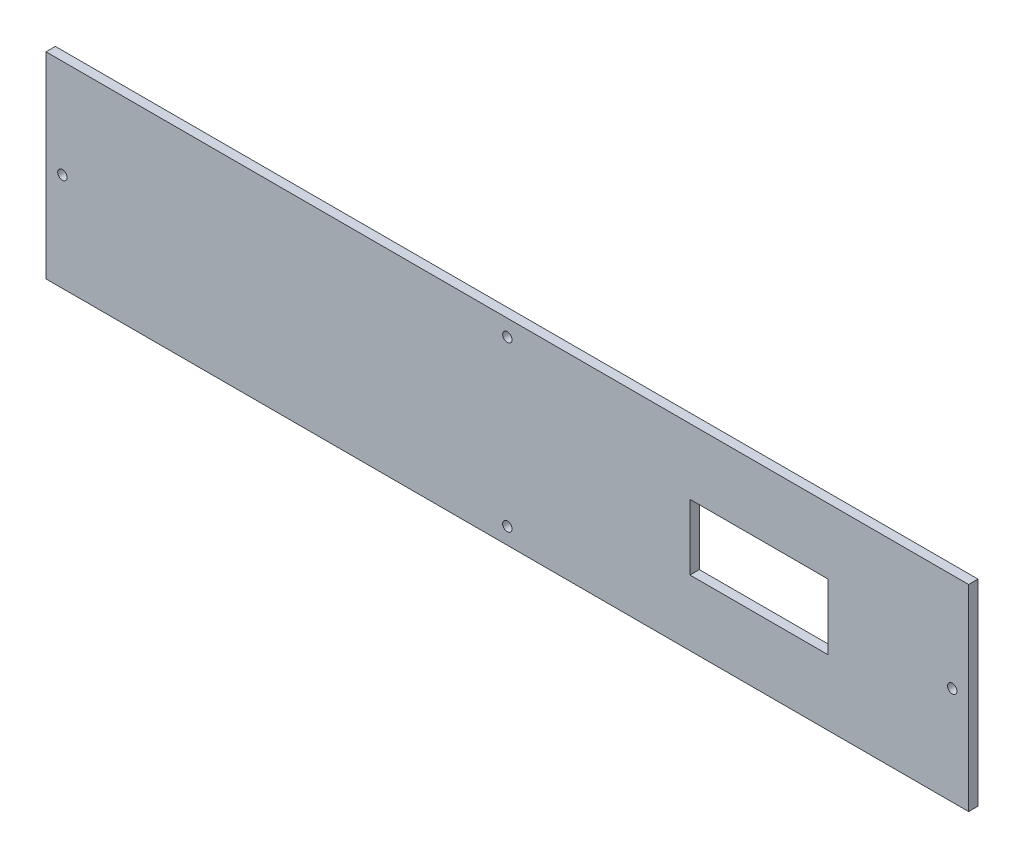
from build123d import *

# Parameters (mm, degrees)
SCHIZZO1_W                   = 394
SCHIZZO1_H                   = 84
SCHIZZO1_R                   = 2
SCHIZZO1_W_2                 = 59
SCHIZZO1_H_2                 = 28
ESTRUSIONE_ESTRUSIONE1_DEPTH = 4


with BuildPart() as part:
    # Schizzo1 → Estrusione-Estrusione1 (new body)
    with BuildSketch(Plane.XY):
        with Locations((197, 42)):
            Rectangle(SCHIZZO1_W, SCHIZZO1_H)
        with Locations((7, 42)):
            Circle(SCHIZZO1_R, mode=Mode.SUBTRACT)
        with Locations((197, 77)):
            Circle(SCHIZZO1_R, mode=Mode.SUBTRACT)
        with Locations((197, 7)):
            Circle(SCHIZZO1_R, mode=Mode.SUBTRACT)
        with Locations((387, 42)):
            Circle(SCHIZZO1_R, mode=Mode.SUBTRACT)
        with Locations((304.5, 42)):
            Rectangle(SCHIZZO1_W_2, SCHIZZO1_H_2, mode=Mode.SUBTRACT)
    extrude(amount=ESTRUSIONE_ESTRUSIONE1_DEPTH)


solid = part.part
